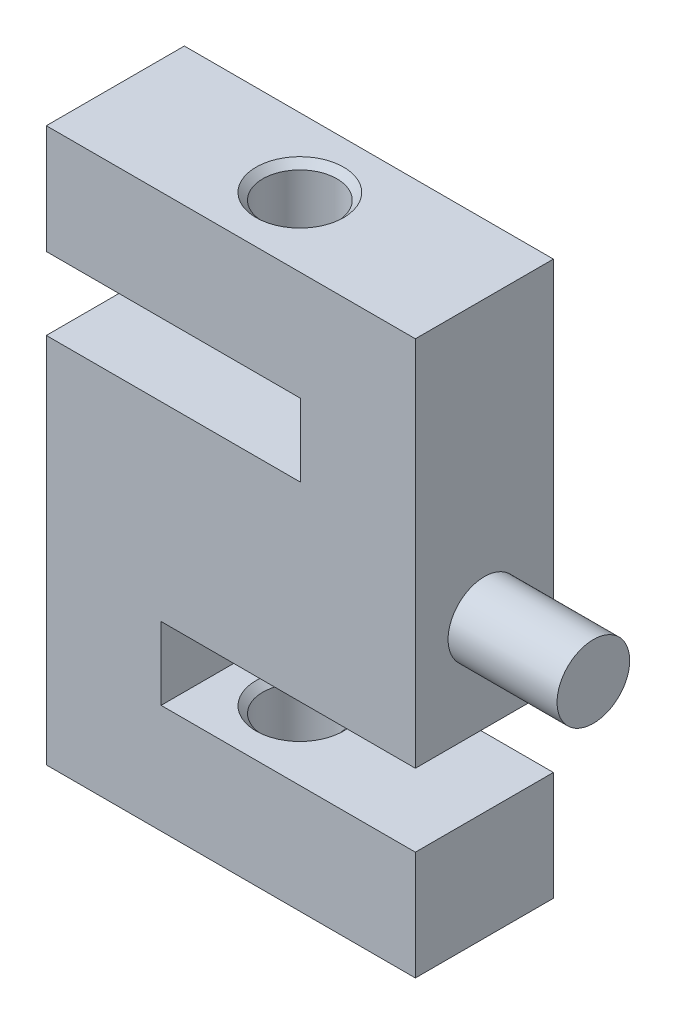
from build123d import *

# Parameters (mm, degrees)
BOSS_EXTRUDE1_DEPTH = 9.5
SKETCH7_R           = 5
DATA_WIRE_DEPTH     = 15


# Read off the part's stored shape, not the designer's step: M12x1.75 Tapped Hole1
with BuildPart() as part:
    # Sketch1 → Boss-Extrude1 (new, symmetric)
    with BuildSketch(Plane.XY):
        Polygon((-25.4, 13.1), (-25.4, -38.1), (25.4, -38.1), (25.4, -23.1), (-9.6, -23.1), (-9.6, -13.1), (25.4, -13.1), (25.4, 38.1), (-25.4, 38.1), (-25.4, 23.1), (9.6, 23.1), (9.6, 13.1), align=None)
    extrude(amount=BOSS_EXTRUDE1_DEPTH, both=True)

    # M12x1.75 Tapped Hole1 outline → M12x1.75 Tapped Hole1 (revolve, cut)
    with BuildSketch(Plane.XY):
        Polygon((0, 23.1), (6.025, 23.1), (5.1, 24.025), (5.1, 37.175), (6.025, 38.1), (0, 38.1), align=None)
    revolve(axis=Axis((0, 0, 0), (0, 1, 0)), mode=Mode.SUBTRACT)

    # Sketch6 → M12x1.75 Tapped Hole2 (revolve, cut)
    with BuildSketch(Plane(origin=(0, -38.1, 0), x_dir=(0, 0, -1), z_dir=(1, 0, 0))):
        Polygon((0, 0), (0, 15), (6.025, 15), (5.1, 14.075), (5.1, 0.925), (6.025, 0), align=None)
    revolve(axis=Axis((0, -44.45, 0), (0, 1, 0)), mode=Mode.SUBTRACT)


with BuildPart() as body_2:
    # Sketch7 → Data Wire (new body)
    with BuildSketch(Plane(origin=(25.4, 0, 0), x_dir=(0, 0, -1), z_dir=(1, 0, 0))):
        Circle(SKETCH7_R)
    extrude(amount=DATA_WIRE_DEPTH)


solid = Compound([part.part, body_2.part])
